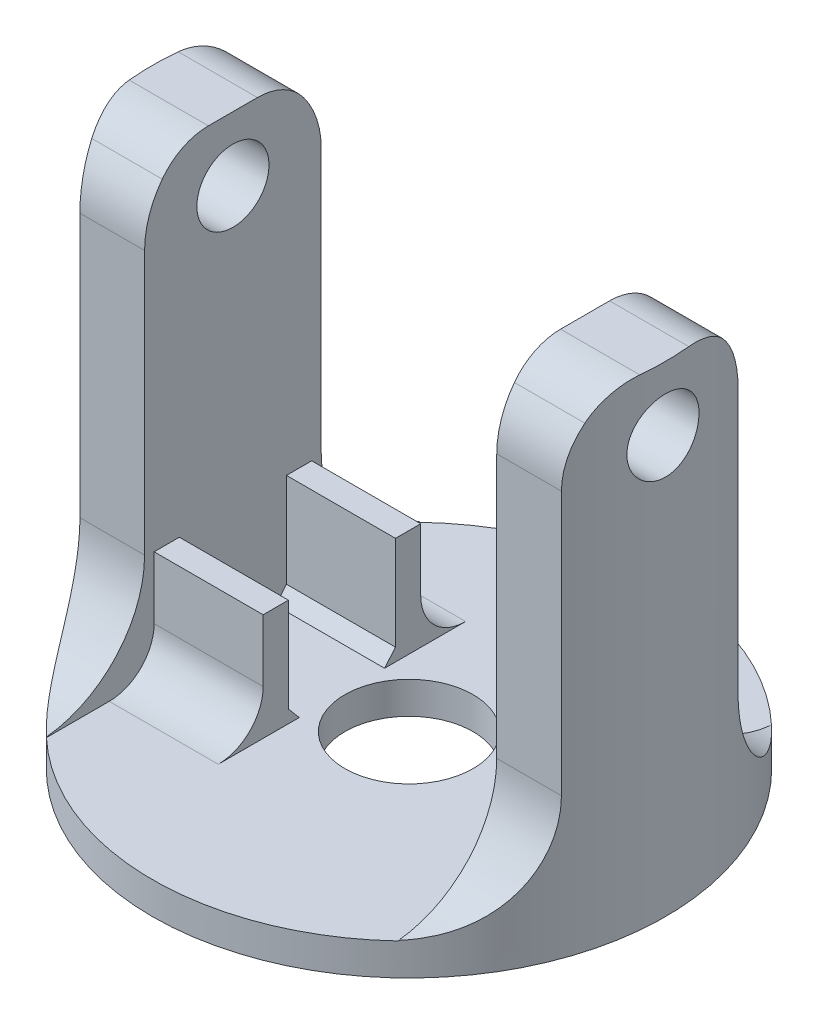
from build123d import *
from build123d.topology import SkipClean

# Parameters (mm, degrees)
SKETCH1_R               = 101.6
BOSS_EXTRUDE1_DEPTH     = 12.7
BOSS_EXTRUDE3_DEPTH     = 177.8
FILLET3_R               = 43.18
SKETCH3_R               = 25.4
CUT_EXTRUDE1_DEPTH      = 229.600000167
CUT_EXTRUDE2_DEPTH      = 276.632670899
CUT_EXTRUDE2_DEPTH_BACK = 276.632670899
SKETCH4_R               = 14.2875
CUT_EXTRUDE3_DEPTH      = 276.6326709
CUT_EXTRUDE3_DEPTH_BACK = 276.6326709
FILLET4_R               = 22.86
SKETCH7_W               = 43.18
SKETCH7_H               = 10
BOSS_EXTRUDE4_DEPTH     = 42.418
BOSS_EXTRUDE5_DEPTH     = 43.18
FILLET5_R               = 17.78


with BuildPart() as part:
    # Sketch1 → Boss-Extrude1 (new body)
    with BuildSketch(Plane(origin=(0, 0, 0), x_dir=(1, 0, 0), z_dir=(0, 1, 0))):
        with Locations(Location((0, 0, 0), (0, 0, 270))):
            Circle(SKETCH1_R)
    extrude(amount=BOSS_EXTRUDE1_DEPTH)

    # Sketch2 → Boss-Extrude3 (add)
    with SkipClean():  # the faces are left unmerged after this step: merging them gives an invalid solid
        with BuildSketch(Plane(origin=(0, 12.7, 0), x_dir=(1, 0, 0), z_dir=(0, 1, 0))):
            with BuildLine():
                Line((-69.749231612, -34.987681034), (-95.385649738, -34.987681034))
                ThreePointArc((-95.385649738, -34.987681034), (-101.6, 0), (-95.385649738, 34.987681034))
                Line((-95.385649738, 34.987681034), (-69.749231612, 34.987681034))
                Line((-69.749231612, 34.987681034), (-69.749231612, -34.987681034))
            make_face()
            with BuildLine():
                Line((69.749231612, 34.987681034), (95.385649738, 34.987681034))
                ThreePointArc((95.385649738, 34.987681034), (101.6, 0), (95.385649738, -34.987681034))
                Line((95.385649738, -34.987681034), (69.749231612, -34.987681034))
                Line((69.749231612, -34.987681034), (69.749231612, 34.987681034))
            make_face()
        extrude(amount=BOSS_EXTRUDE3_DEPTH)

    # Fillet3
    # the kernel refuses this fillet: 43.18 mm, written as the material it adds along each edge
    with BuildSketch(Plane(origin=(-203.335649738, 12.7, -34.987681034), x_dir=(0, 0, -1), z_dir=(1, 0, 0))) as fillet3_piece_1_section:
        with BuildLine():
            CenterArc((FILLET3_R, FILLET3_R), FILLET3_R, 180, 90)
            Line((0, FILLET3_R), (0, 0))
            Line((0, 0), (FILLET3_R, 0))
        make_face()
    fillet3_piece_1 = extrude(amount=133.586418126, mode=Mode.PRIVATE)
    fillet3_piece_1 = fillet3_piece_1 & Plane(origin=(0, 23.799745308, 0), x_dir=(0, 0, 1), z_dir=(0, -1, 0)) * Cylinder(101.6, 440, mode=Mode.PRIVATE)
    add(fillet3_piece_1)
    with BuildSketch(Plane(origin=(203.335649738, 12.7, 34.987681034), x_dir=(0, 0, 1), z_dir=(-1, 0, 0))) as fillet3_piece_2_section:
        with BuildLine():
            CenterArc((FILLET3_R, FILLET3_R), FILLET3_R, 180, 90)
            Line((0, FILLET3_R), (0, 0))
            Line((0, 0), (FILLET3_R, 0))
        make_face()
    fillet3_piece_2 = extrude(amount=133.586418126, mode=Mode.PRIVATE)
    fillet3_piece_2 = fillet3_piece_2 & Plane(origin=(0, 23.799745308, 0), x_dir=(0, 0, 1), z_dir=(0, -1, 0)) * Cylinder(101.6, 440, mode=Mode.PRIVATE)
    add(fillet3_piece_2)
    with BuildSketch(Plane(origin=(69.749231612, 12.7, -34.987681034), x_dir=(0, 0, -1), z_dir=(1, 0, 0))) as fillet3_piece_3_section:
        with BuildLine():
            CenterArc((FILLET3_R, FILLET3_R), FILLET3_R, 180, 90)
            Line((0, FILLET3_R), (0, 0))
            Line((0, 0), (FILLET3_R, 0))
        make_face()
    fillet3_piece_3 = extrude(amount=133.586418126, mode=Mode.PRIVATE)
    fillet3_piece_3 = fillet3_piece_3 & Plane(origin=(0, 23.79973444, 0), x_dir=(0, 0, 1), z_dir=(0, -1, 0)) * Cylinder(101.6, 440, mode=Mode.PRIVATE)
    add(fillet3_piece_3)
    with BuildSketch(Plane(origin=(-69.749231612, 12.7, 34.987681034), x_dir=(0, 0, 1), z_dir=(-1, 0, 0))) as fillet3_piece_4_section:
        with BuildLine():
            CenterArc((FILLET3_R, FILLET3_R), FILLET3_R, 180, 90)
            Line((0, FILLET3_R), (0, 0))
            Line((0, 0), (FILLET3_R, 0))
        make_face()
    fillet3_piece_4 = extrude(amount=133.586418126, mode=Mode.PRIVATE)
    fillet3_piece_4 = fillet3_piece_4 & Plane(origin=(0, 23.79973444, 0), x_dir=(0, 0, 1), z_dir=(0, -1, 0)) * Cylinder(101.6, 440, mode=Mode.PRIVATE)
    add(fillet3_piece_4)

    # Sketch3 → Cut-Extrude1 (cut, through all)
    with BuildSketch(Plane(origin=(0, 12.7, 0), x_dir=(1, 0, 0), z_dir=(0, 1, 0))):
        with Locations(Location((0, 0, 0), (0, 0, 270))):
            Circle(SKETCH3_R)
    extrude(amount=-CUT_EXTRUDE1_DEPTH, mode=Mode.SUBTRACT)

    # Sketch4 → Cut-Extrude2 (cut, two sides: drawn at the far end of the back side and taken through both)
    with BuildSketch(Plane.ZY.offset(-69.749231612).offset(-CUT_EXTRUDE2_DEPTH_BACK)):
        with Locations((0, 165.1)):
            Circle(SKETCH4_R)
    extrude(amount=CUT_EXTRUDE2_DEPTH + CUT_EXTRUDE2_DEPTH_BACK, mode=Mode.SUBTRACT)

    # Sketch5 → Cut-Extrude3 (cut, two sides: drawn at the far end of the back side and taken through both)
    with BuildSketch(Plane.ZY.offset(-69.749231612).offset(-CUT_EXTRUDE3_DEPTH_BACK)):
        with BuildLine():
            Line((34.987681034, 160.366849855), (34.987681034, 209.992755937))
            Line((34.987681034, 209.992755937), (-34.987681034, 209.992755937))
            Line((-34.987681034, 209.992755937), (-34.987681034, 160.366849855))
            ThreePointArc((-34.987681034, 160.366849855), (0, 195.354530889), (34.987681034, 160.366849855))
        make_face()
    extrude(amount=CUT_EXTRUDE3_DEPTH + CUT_EXTRUDE3_DEPTH_BACK, mode=Mode.SUBTRACT)

    # Fillet4
    fillet4_edges = [part.edges().sort_by_distance(p)[0] for p in [
        (-84.890685507, 190.5, -17.780075547),
        (-84.890685507, 190.5, 17.780075547),
        (84.890685507, 190.5, -17.780075547),
        (84.890685507, 190.5, 17.780075547),
    ]]
    fillet(fillet4_edges, radius=FILLET4_R)

    # Sketch7 → Boss-Extrude4 (add)
    with BuildSketch(Plane(origin=(0, 12.7, 0), x_dir=(1, 0, 0), z_dir=(0, 1, 0))):
        with Locations((-48.159231612, 26.209)):
            Rectangle(SKETCH7_W, SKETCH7_H)
        with Locations((-48.159231612, -26.209)):
            Rectangle(SKETCH7_W, SKETCH7_H)
    extrude(amount=BOSS_EXTRUDE4_DEPTH)

    # Sketch8 → Boss-Extrude5 (add)
    with BuildSketch(Plane(origin=(-69.749231612, 0, 0), x_dir=(0, 0, -1), z_dir=(1, 0, 0))):
        Polygon((-21.209, 17.78), (-21.209, 12.7), (-16.891, 12.7), align=None)
        Polygon((16.891, 12.7), (21.209, 17.78), (21.209, 12.7), align=None)
    extrude(amount=BOSS_EXTRUDE5_DEPTH)

    # Fillet5
    fillet5_edges = [part.edges().sort_by_distance(p)[0] for p in [
        (-48.159231612, 12.7, -31.209),
        (-48.159231612, 12.7, 31.209),
    ]]
    fillet(fillet5_edges, radius=FILLET5_R)


solid = part.part
